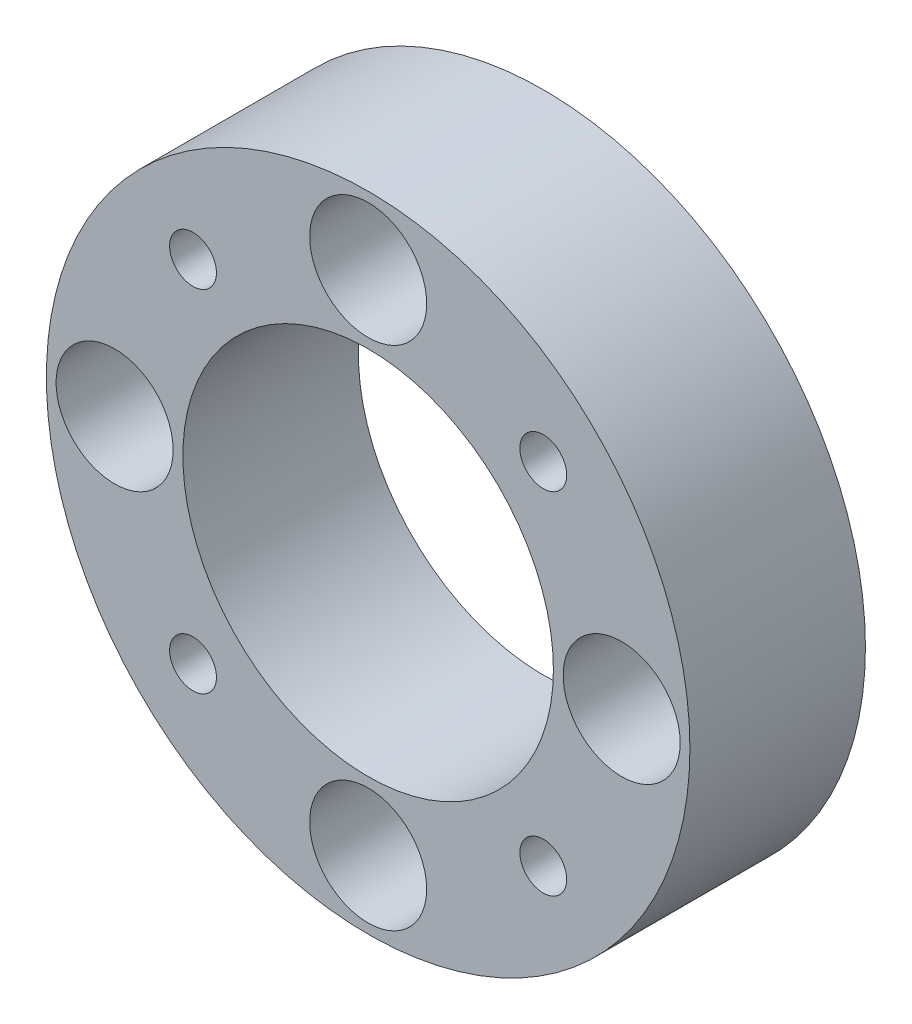
from build123d import *

# Parameters (mm, degrees)
SKETCH1_R           = 16.5
SKETCH1_R_2         = 1.2
SKETCH1_R_3         = 9.5
SKETCH1_R_4         = 1.55
BOSS_EXTRUDE1_DEPTH = 9
SKETCH2_R           = 3
CUT_EXTRUDE1_DEPTH  = 6


with BuildPart() as part:
    # Sketch1 → Boss-Extrude1 (new body)
    with BuildSketch(Plane.XY):
        Circle(SKETCH1_R)
        with Locations((8.980256121, 8.980256121)):
            Circle(SKETCH1_R_2, mode=Mode.SUBTRACT)
        with Locations((8.980256121, -8.980256121)):
            Circle(SKETCH1_R_2, mode=Mode.SUBTRACT)
        with Locations((-8.980256121, -8.980256121)):
            Circle(SKETCH1_R_2, mode=Mode.SUBTRACT)
        with Locations((-8.980256121, 8.980256121)):
            Circle(SKETCH1_R_2, mode=Mode.SUBTRACT)
        Circle(SKETCH1_R_3, mode=Mode.SUBTRACT)
        with Locations((0, 13)):
            Circle(SKETCH1_R_4, mode=Mode.SUBTRACT)
        with Locations((13, 0)):
            Circle(SKETCH1_R_4, mode=Mode.SUBTRACT)
        with Locations((0, -13)):
            Circle(SKETCH1_R_4, mode=Mode.SUBTRACT)
        with Locations((-13, 0)):
            Circle(SKETCH1_R_4, mode=Mode.SUBTRACT)
    extrude(amount=BOSS_EXTRUDE1_DEPTH)

    # Sketch2 → Cut-Extrude1 (cut)
    with BuildSketch(Plane.XY.offset(9)):
        with Locations((0, 13)):
            Circle(SKETCH2_R)
        with Locations((13, 0)):
            Circle(SKETCH2_R)
        with Locations((0, -13)):
            Circle(SKETCH2_R)
        with Locations((-13, 0)):
            Circle(SKETCH2_R)
    extrude(amount=-CUT_EXTRUDE1_DEPTH, mode=Mode.SUBTRACT)


solid = part.part
